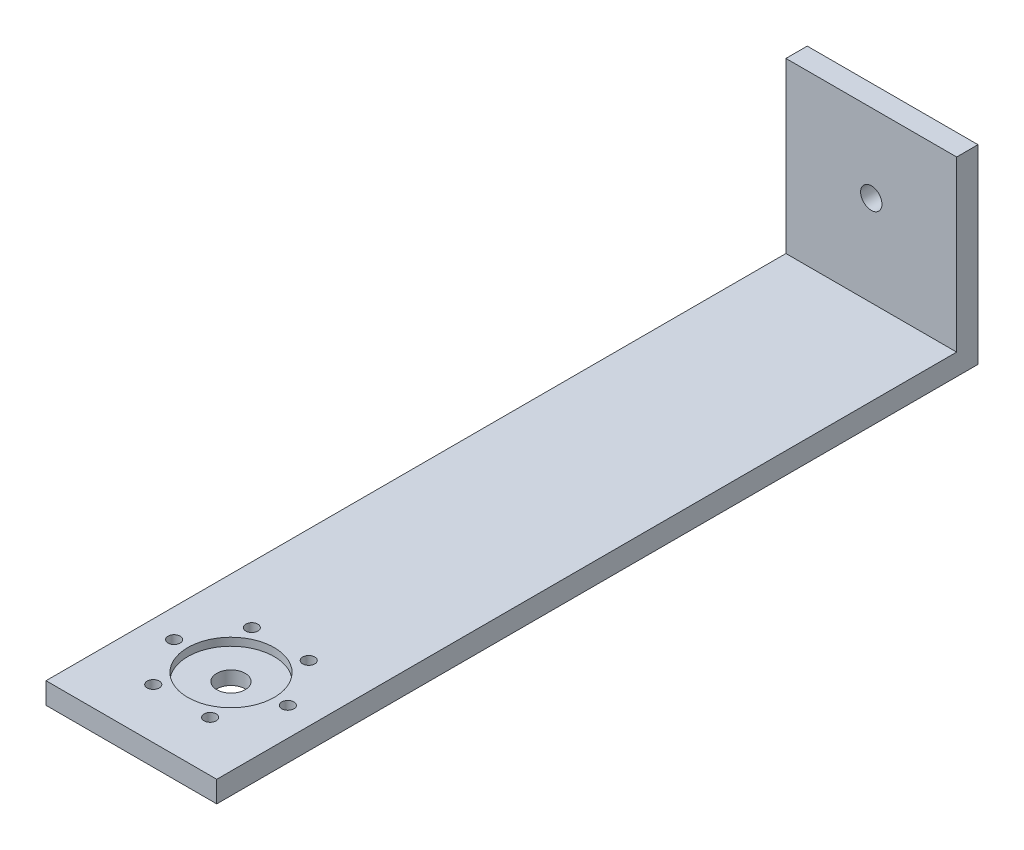
from build123d import *

# Parameters (mm, degrees)
SK_FOREARM_PLATE_W       = 48
SK_FOREARM_PLATE_H       = 208
SK_FOREARM_PLATE_R       = 1.7
SK_FOREARM_PLATE_R_2     = 4
FOREARM_PLATE_DEPTH      = 6
SK_ELBOW_PILOT_RECESS_R  = 12.15
ELBOW_PILOT_RECESS_DEPTH = 2.2
SK_HAND_PLATE_W          = 48
SK_HAND_PLATE_H          = 53.5
SK_HAND_PLATE_R          = 3
HAND_PLATE_DEPTH         = 6


with BuildPart() as part:
    # SK_Forearm_Plate → Forearm_Plate (new body)
    with BuildSketch(Plane(origin=(0, -31.5, 0), x_dir=(1, 0, 0), z_dir=(0, 1, 0))):
        with Locations((0, 76)):
            Rectangle(SK_FOREARM_PLATE_W, SK_FOREARM_PLATE_H)
        with Locations((16, 0)):
            Circle(SK_FOREARM_PLATE_R, mode=Mode.SUBTRACT)
        with Locations((8, 13.856406461)):
            Circle(SK_FOREARM_PLATE_R, mode=Mode.SUBTRACT)
        with Locations((-8, 13.856406461)):
            Circle(SK_FOREARM_PLATE_R, mode=Mode.SUBTRACT)
        with Locations((-16, 0)):
            Circle(SK_FOREARM_PLATE_R, mode=Mode.SUBTRACT)
        with Locations((-8, -13.856406461)):
            Circle(SK_FOREARM_PLATE_R, mode=Mode.SUBTRACT)
        with Locations((8, -13.856406461)):
            Circle(SK_FOREARM_PLATE_R, mode=Mode.SUBTRACT)
        Circle(SK_FOREARM_PLATE_R_2, mode=Mode.SUBTRACT)
    extrude(amount=FOREARM_PLATE_DEPTH)

    # SK_Elbow_Pilot_Recess → Elbow_Pilot_Recess (cut)
    with BuildSketch(Plane(origin=(0, -25.5, 0), x_dir=(1, 0, 0), z_dir=(0, 1, 0))):
        Circle(SK_ELBOW_PILOT_RECESS_R)
    extrude(amount=-ELBOW_PILOT_RECESS_DEPTH, mode=Mode.SUBTRACT)

    # SK_Hand_Plate → Hand_Plate (add)
    with BuildSketch(Plane.XY.offset(-186)):
        with Locations((0, -4.75)):
            Rectangle(SK_HAND_PLATE_W, SK_HAND_PLATE_H)
        Circle(SK_HAND_PLATE_R, mode=Mode.SUBTRACT)
    extrude(amount=HAND_PLATE_DEPTH)


solid = part.part
